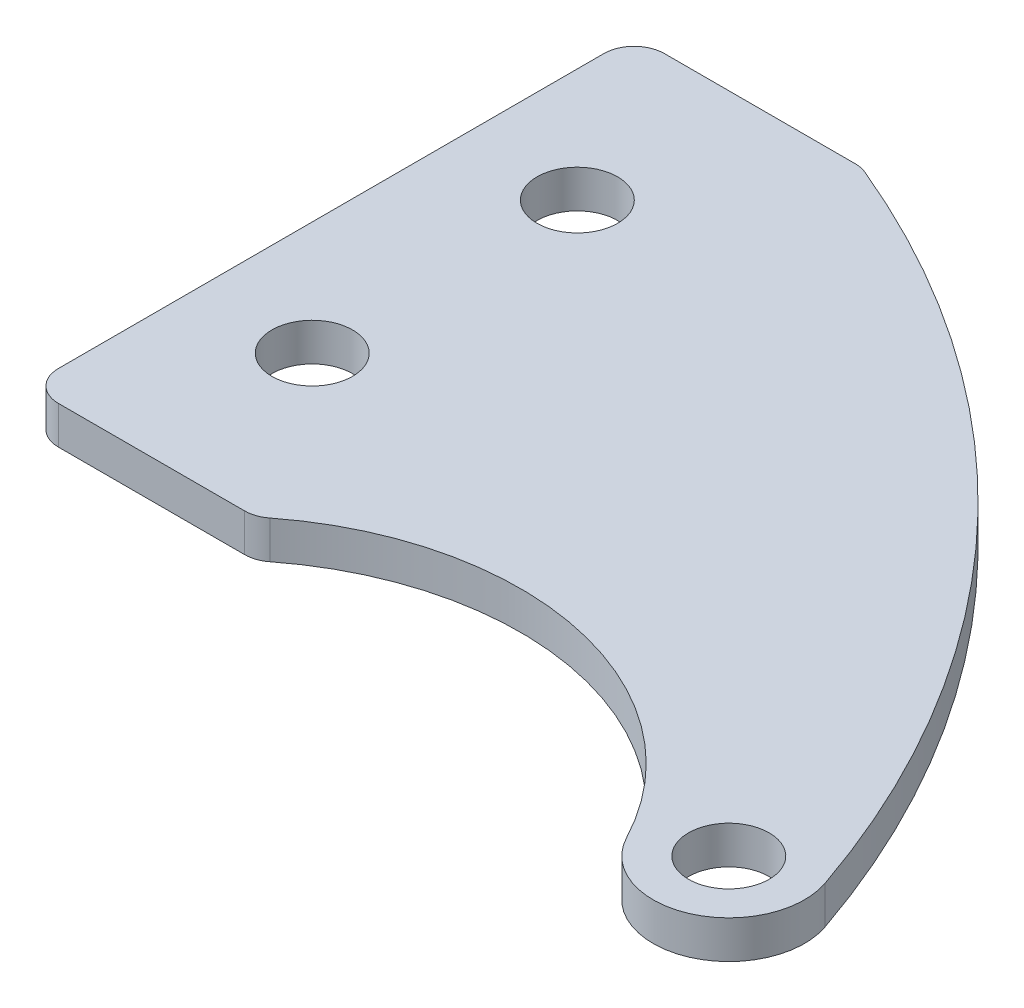
from build123d import *

# Parameters (mm, degrees)
BOSS_EXTRUDE1_DEPTH     = 3.175
F_1_4_CLEARANCE_HOLE2_D = 6.7564
F_1_4_CLEARANCE_HOLE1_D = 6.7564
FILLET1_R               = 2.54


with BuildPart() as part:
    # Sketch1 → Boss-Extrude1 (new body)
    with BuildSketch(Plane(origin=(0, 0, 0), x_dir=(1, 0, 0), z_dir=(0, 1, 0))):
        with BuildLine():
            Line((0, 50.8), (19.05, 50.8))
            ThreePointArc((19.05, 50.8), (50.071704537, 29.509022599), (69.508138319, -2.70707451))
            ThreePointArc((69.508138319, -2.70707451), (66.00569764, -10.597221873), (57.8723837, -7.70400213))
            ThreePointArc((57.8723837, -7.70400213), (40.305945959, 5.444173912), (19.05, 0))
            Line((19.05, 0), (0, 0))
            Line((0, 0), (0, 50.8))
        make_face()
    extrude(amount=BOSS_EXTRUDE1_DEPTH)

    # 1/4 Clearance Hole2 (through all)
    with Locations(Plane(origin=(0, 0, 0), x_dir=(-1, 0, 0), z_dir=(0, -1, 0))):
        with Locations((-63.5, -4.7625)):
            Hole(F_1_4_CLEARANCE_HOLE2_D / 2)

    # 1/4 Clearance Hole1 (through all)
    with Locations(Plane(origin=(0, 3.175, 0), x_dir=(1, 0, 0), z_dir=(0, 1, 0))):
        with Locations((9.525, 36.5125), (9.525, 14.2875)):
            Hole(F_1_4_CLEARANCE_HOLE1_D / 2)

    # Fillet1
    fillet1_edges = [part.edges().sort_by_distance(p)[0] for p in [
        (19.05, 1.5875, 0),
        (0, 1.5875, 0),
        (0, 1.5875, -50.8),
        (19.05, 1.5875, -50.8),
    ]]
    fillet(fillet1_edges, radius=FILLET1_R)


solid = part.part
